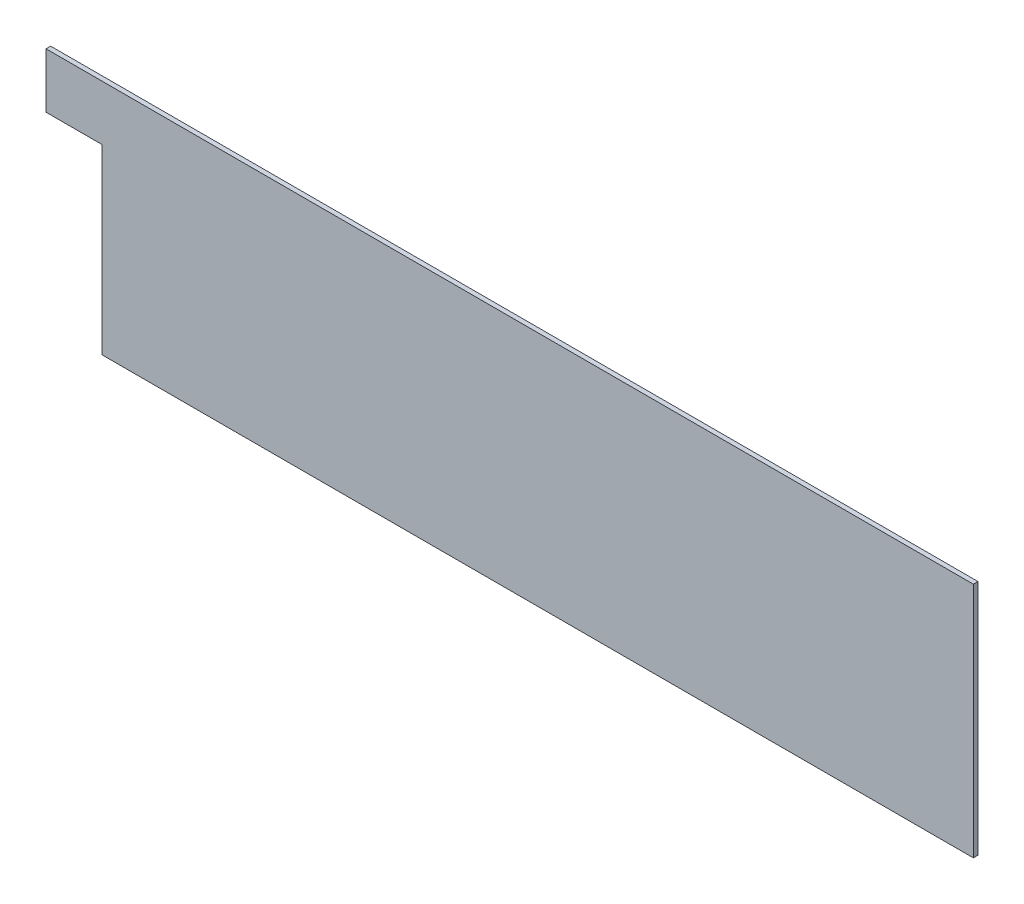
from build123d import *

# Parameters (mm, degrees)
TABAN_FLAN_1_DEPTH         = 30
KES_EKSTR_ZYON1_DEPTH      = 6219.771984886
KES_EKSTR_ZYON1_DEPTH_BACK = 6219.771984886
IZIM2_W                    = 365
IZIM2_H                    = 658


# Sheet-metal steps are written as plain solids
with BuildPart() as part:
    # Çizim1 → Taban-Flanş1 (new body)
    with BuildSketch(Plane.XY):
        Polygon((0, 0), (0, -1015), (365, -1015), (365, -1540), (6025, -1540), (6025, 0), align=None)
    extrude(amount=-TABAN_FLAN_1_DEPTH)

    # Çizim2 → Kes-Ekstrüzyon1 (cut, two sides: drawn at the far end of the back side and taken through both)
    with BuildSketch(Plane.XY.offset(-KES_EKSTR_ZYON1_DEPTH_BACK)):
        with Locations((182.5, -686)):
            Rectangle(IZIM2_W, IZIM2_H)
    extrude(amount=KES_EKSTR_ZYON1_DEPTH + KES_EKSTR_ZYON1_DEPTH_BACK, mode=Mode.SUBTRACT)


solid = part.part
